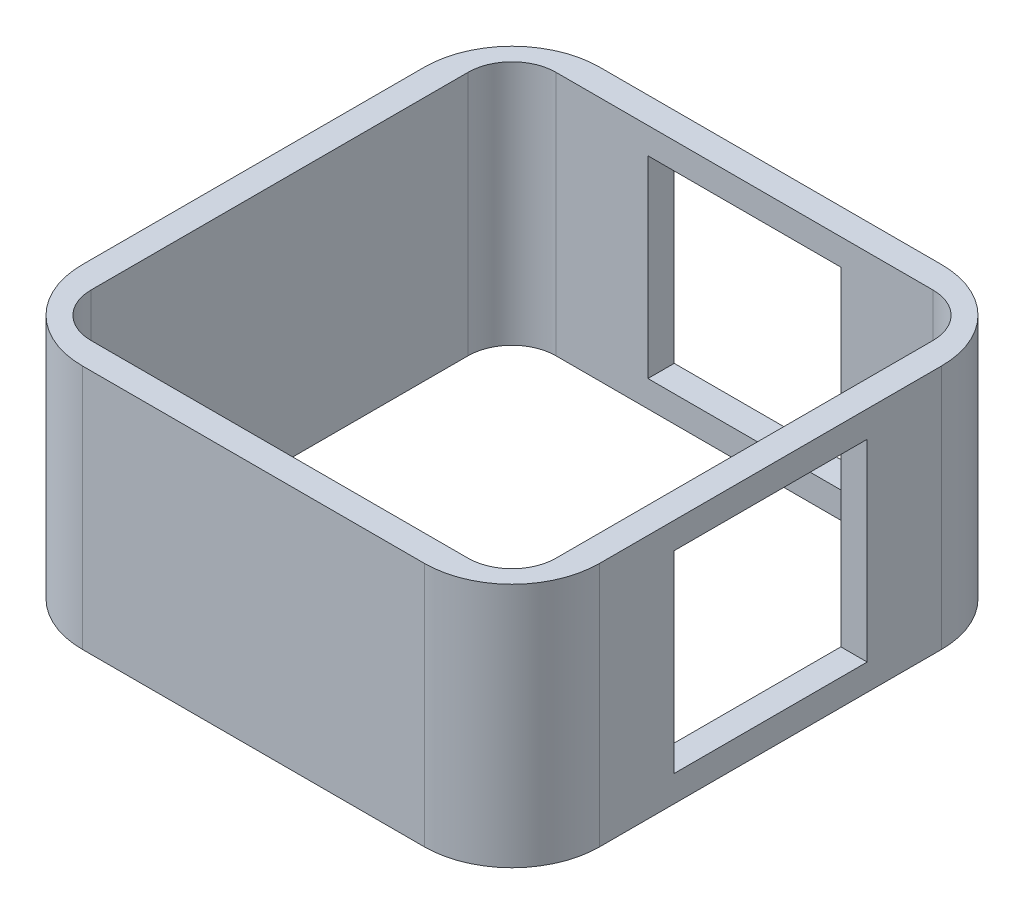
from build123d import *

# Parameters (mm, degrees)
SKETCH1_W           = 59
SKETCH1_H           = 59
SKETCH1_W_2         = 53
SKETCH1_H_2         = 53
BOSS_EXTRUDE1_DEPTH = 28
FILLET1_R           = 10
FILLET2_R           = 5
SKETCH3_W           = 22
SKETCH3_H           = 22
CUT_EXTRUDE2_DEPTH  = 3
CUT_EXTRUDE4_REACH  = 73.661
SKETCH5_W           = 22
SKETCH5_H           = 22


with BuildPart() as part:
    # Sketch1 → Boss-Extrude1 (new body)
    with BuildSketch(Plane(origin=(0, 0, 0), x_dir=(1, 0, 0), z_dir=(0, 1, 0))):
        Rectangle(SKETCH1_W, SKETCH1_H)
        Rectangle(SKETCH1_W_2, SKETCH1_H_2, mode=Mode.SUBTRACT)
    extrude(amount=BOSS_EXTRUDE1_DEPTH)

    # Fillet1
    fillet1_edges = [part.edges().sort_by_distance(p)[0] for p in [
        (29.5, 14, -29.5),
        (29.5, 14, 29.5),
        (-29.5, 14, 29.5),
        (-29.5, 14, -29.5),
    ]]
    fillet(fillet1_edges, radius=FILLET1_R)

    # Fillet2
    fillet2_edges = [part.edges().sort_by_distance(p)[0] for p in [
        (-26.5, 14, -26.5),
        (-26.5, 14, 26.5),
        (26.5, 14, 26.5),
        (26.5, 14, -26.5),
    ]]
    fillet(fillet2_edges, radius=FILLET2_R)

    # Sketch3 → Cut-Extrude2 (cut)
    with BuildSketch(Plane(origin=(0, 0, -29.5), x_dir=(-1, 0, 0), z_dir=(0, 0, -1))):
        with Locations((0, 14)):
            Rectangle(SKETCH3_W, SKETCH3_H)
    extrude(amount=-CUT_EXTRUDE2_DEPTH, mode=Mode.SUBTRACT)

    # Sketch5 → Cut-Extrude4 (cut, up to next)
    with BuildSketch(Plane(origin=(29.5, 0, 0), x_dir=(0, 0, -1), z_dir=(1, 0, 0)), mode=Mode.PRIVATE) as cut_extrude4_sk1:
        with Locations((0, 14)):
            Rectangle(SKETCH5_W, SKETCH5_H)
    cut_extrude4_tool1 = extrude(cut_extrude4_sk1.sketch, amount=-CUT_EXTRUDE4_REACH, mode=Mode.PRIVATE) & part.part
    add(cut_extrude4_tool1.solids().sort_by_distance((29.5, 14, 0))[0], mode=Mode.SUBTRACT)


solid = part.part
